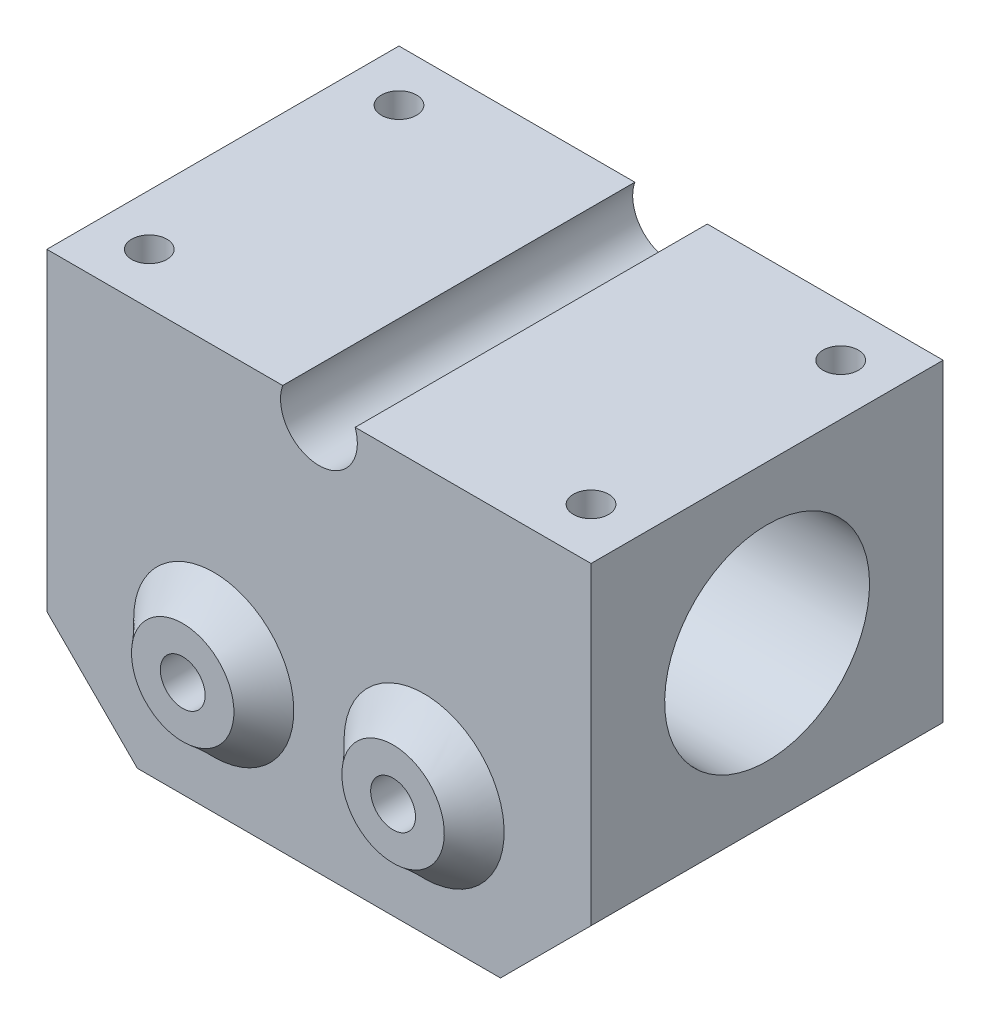
from build123d import *

# Parameters (mm, degrees)
BOSS_EXTRUDE1_DEPTH = 27.5
CUT_EXTRUDE1_DEPTH  = 55
SKETCH3_R           = 10.5
CUT_EXTRUDE2_DEPTH  = 85
SKETCH4_R           = 16
SKETCH4_R_2         = 10.5
CUT_EXTRUDE3_DEPTH  = 32.3
CUT_EXTRUDE4_START  = -32.3
SKETCH5_R           = 16
SKETCH5_R_2         = 10.5
CUT_EXTRUDE4_DEPTH  = 32.3
SKETCH6_R           = 2.75
CUT_EXTRUDE5_DEPTH  = 15
SKETCH9_R           = 3.5
CUT_EXTRUDE6_DEPTH  = 15


with BuildPart() as part:
    # Sketch1 → Boss-Extrude1 (new, symmetric)
    with BuildSketch(Plane.XY):
        Polygon((0, 0), (0, -49), (-14.142135624, -63.142135624), (-70.857864376, -63.142135624), (-85, -49), (-85, 0), align=None)
    extrude(amount=BOSS_EXTRUDE1_DEPTH, both=True)

    # Sketch2 → Cut-Extrude1 (cut)
    with BuildSketch(Plane.XY.offset(27.5)):
        with BuildLine():
            Line((-36.843145751, 0), (-48.156854249, 0))
            ThreePointArc((-48.156854249, 0), (-42.5, -8), (-36.843145751, 0))
        make_face()
    extrude(amount=-CUT_EXTRUDE1_DEPTH, mode=Mode.SUBTRACT)

    # Sketch3 → Cut-Extrude2 (cut)
    with BuildSketch(Plane(origin=(0, 0, 0), x_dir=(0, 0, -1), z_dir=(1, 0, 0))):
        with Locations(Location((0, -24.5, 0), (0, 0, 90))):
            Circle(SKETCH3_R)
    extrude(amount=-CUT_EXTRUDE2_DEPTH, mode=Mode.SUBTRACT)

    # Sketch4 → Cut-Extrude3 (cut)
    with BuildSketch(Plane(origin=(0, 0, 0), x_dir=(0, 0, -1), z_dir=(1, 0, 0))):
        with Locations(Location((0, -24.5, 0), (0, 0, 90))):
            Circle(SKETCH4_R)
        with Locations(Location((0, -24.5, 0), (0, 0, 90))):
            Circle(SKETCH4_R_2, mode=Mode.SUBTRACT)
    extrude(amount=-CUT_EXTRUDE3_DEPTH, mode=Mode.SUBTRACT)

    # Sketch5 → Cut-Extrude4 (cut)
    with BuildSketch(Plane.ZY.offset(85).offset(CUT_EXTRUDE4_START)):
        with Locations(Location((0, -24.5, 0), (0, 0, 90))):
            Circle(SKETCH5_R)
        with Locations(Location((0, -24.5, 0), (0, 0, 90))):
            Circle(SKETCH5_R_2, mode=Mode.SUBTRACT)
    extrude(amount=CUT_EXTRUDE4_DEPTH, mode=Mode.SUBTRACT)

    # Sketch6 → Cut-Extrude5 (cut)
    with BuildSketch(Plane(origin=(0, 0, 0), x_dir=(1, 0, 0), z_dir=(0, 1, 0))):
        with Locations(Location((-8, 19.5, 0), (0, 0, 180))):
            Circle(SKETCH6_R)
        with Locations((-8, -19.5)):
            Circle(SKETCH6_R)
        with Locations(Location((-77, -19.5, 0), (0, 0, 180))):
            Circle(SKETCH6_R)
        with Locations((-77, 19.5)):
            Circle(SKETCH6_R)
    extrude(amount=-CUT_EXTRUDE5_DEPTH, mode=Mode.SUBTRACT)

    # Loft1: read off the stored shape, not the designer's step
    # Loft1: loft between two sections, ruled curve by curve
    loft1_from = [
        Edge.make_bspline([(-20.976227121, -31.727080746, 27.5), (-43.806336876, -21.539534988, 27.5), (-53.993882634, -44.369644744, 27.5), (-31.163772879, -54.557190501, 27.5), (-8.333663124, -64.744736259, 27.5), (1.853882634, -41.914626504, 27.5), (-20.976227121, -31.727080746, 27.5)], [0, 0, 0, 0, 0.5, 0.5, 0.5, 1, 1, 1, 1], 3, [1, 0.333333333, 0.333333333, 1, 0.333333333, 0.333333333, 1]),
    ]
    loft1_to = [
        Edge.make_bspline([(-20.63774875, -37.26926185, 32.35), (-32.383496297, -26.40475935, 32.35), (-43.247998797, -38.150506897, 32.35), (-31.50225125, -49.015009397, 32.35), (-19.756503703, -59.879511897, 32.35), (-8.892001203, -48.13376435, 32.35), (-20.63774875, -37.26926185, 32.35)], [0, 0, 0, 0, 0.5, 0.5, 0.5, 1, 1, 1, 1], 3, [1, 0.333333333, 0.333333333, 1, 0.333333333, 0.333333333, 1]),
    ]
    loft1 = Solid(Shell([*[Face.make_surface_from_curves(loft1_from[k], loft1_to[k]) for k in range(1)], Face(Wire(loft1_from)), Face(Wire(loft1_to))]))
    add(loft1)

    # Sketch9 → Cut-Extrude6 (cut)
    with BuildSketch(Plane.XY.offset(32.35)):
        with Locations((-26.07, -43.142135624)):
            Circle(SKETCH9_R)
    cut_extrude6 = extrude(amount=-CUT_EXTRUDE6_DEPTH, mode=Mode.SUBTRACT)

    # Mirror1: Loft1, Cut-Extrude6 across plane
    add(loft1.mirror(Plane(origin=(-42.5, 0, 0), x_dir=(0, 0, 1), z_dir=(1, 0, 0))))
    add(cut_extrude6.mirror(Plane(origin=(-42.5, 0, 0), x_dir=(0, 0, 1), z_dir=(1, 0, 0))), mode=Mode.SUBTRACT)


solid = part.part
